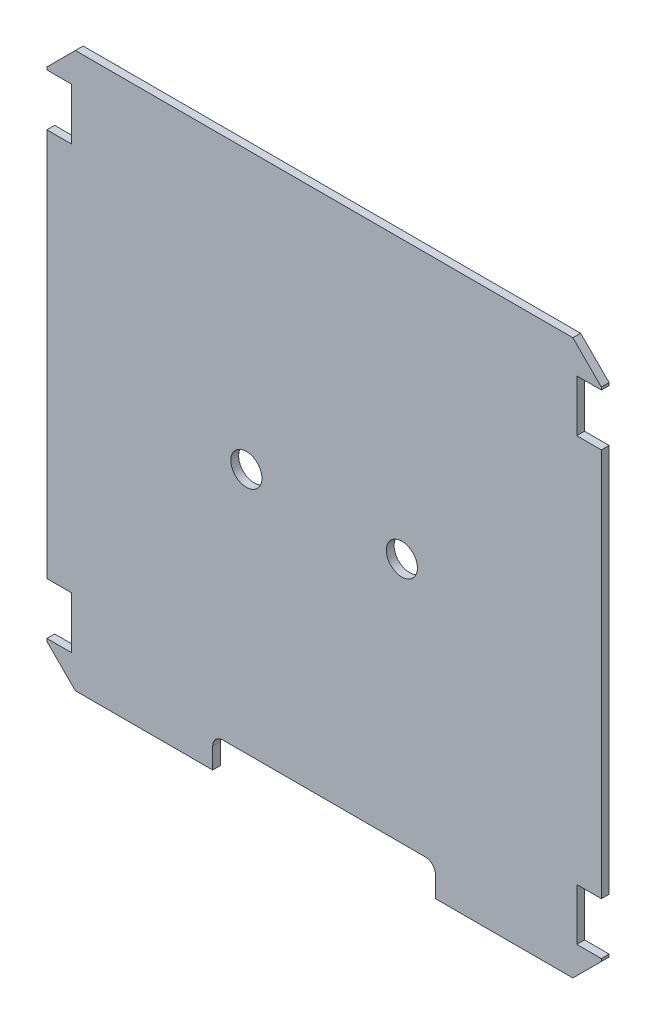
from build123d import *

# Parameters (mm, degrees)
SKETCH1_W           = 214
SKETCH1_H           = 214
SKETCH1_R           = 1.6
BOSS_EXTRUDE1_DEPTH = 3
SKETCH2_R           = 6
SKETCH2_W           = 86
SKETCH2_H           = 12
SKETCH2_W_2         = 9.494873413
SKETCH2_H_2         = 20
CUT_EXTRUDE1_DEPTH  = 152.350586388
FILLET1_R           = 4
CHAMFER1_SIZE       = 11


with BuildPart() as part:
    # Sketch1 → Boss-Extrude1 (new body)
    with BuildSketch(Plane.XY):
        Rectangle(SKETCH1_W, SKETCH1_H)
        with Locations((0, -104.5)):
            Circle(SKETCH1_R, mode=Mode.SUBTRACT)
    extrude(amount=BOSS_EXTRUDE1_DEPTH)

    # Sketch2 → Cut-Extrude1 (cut, through all)
    with BuildSketch(Plane.XY.offset(3)):
        with Locations((30, 0)):
            Circle(SKETCH2_R)
        with Locations((-30, 0)):
            Circle(SKETCH2_R)
        with Locations((0, -101)):
            Rectangle(SKETCH2_W, SKETCH2_H)
        with Locations((-102.252563294, -85)):
            Rectangle(SKETCH2_W_2, SKETCH2_H_2)
        with Locations((-102.252563294, 85)):
            Rectangle(SKETCH2_W_2, SKETCH2_H_2)
        with Locations((102.252563294, 85)):
            Rectangle(SKETCH2_W_2, SKETCH2_H_2)
        with Locations((102.252563294, -85)):
            Rectangle(SKETCH2_W_2, SKETCH2_H_2)
    extrude(amount=-CUT_EXTRUDE1_DEPTH, mode=Mode.SUBTRACT)

    # Fillet1
    fillet1_edges = [part.edges().sort_by_distance(p)[0] for p in [
        (43, -95, 1.5),
        (-43, -95, 1.5),
    ]]
    fillet(fillet1_edges, radius=FILLET1_R)

    # Chamfer1
    chamfer1_edges = [part.edges().sort_by_distance(p)[0] for p in [
        (107, 107, 1.5),
        (-107, 107, 1.5),
        (-107, -107, 1.5),
        (107, -107, 1.5),
    ]]
    chamfer(chamfer1_edges, length=CHAMFER1_SIZE)


solid = part.part
